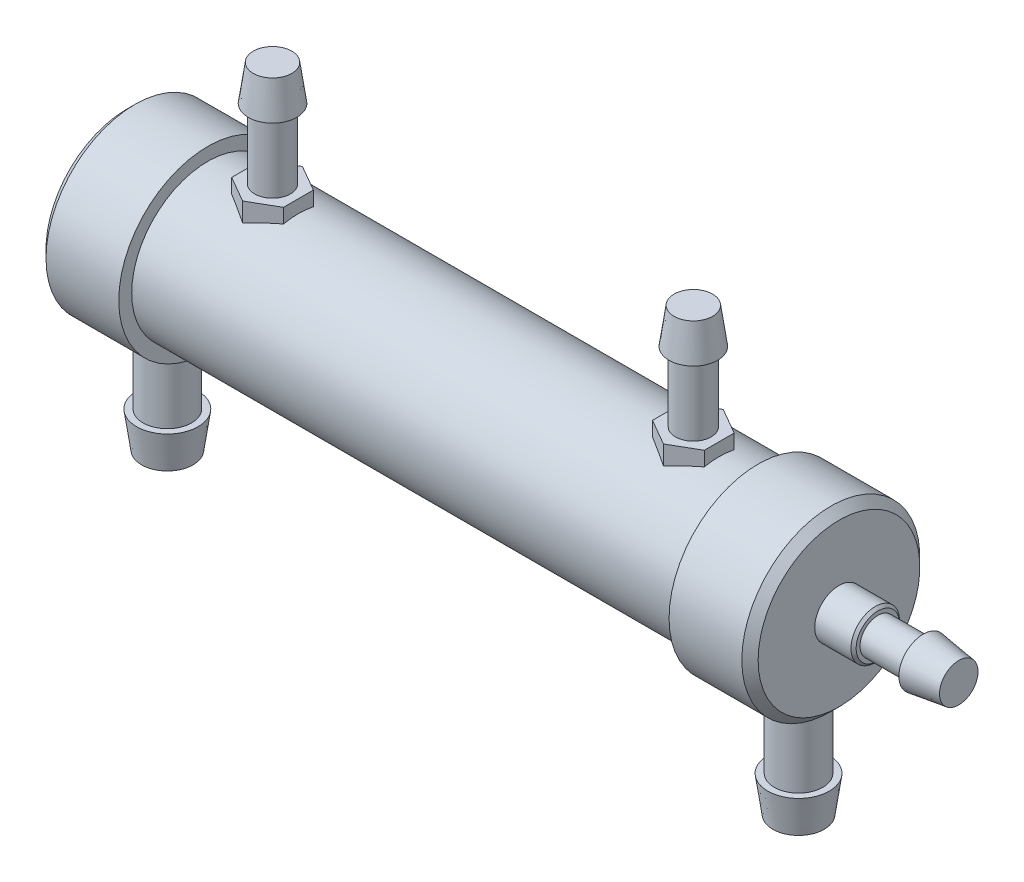
from build123d import *

# Parameters (mm, degrees)
BOSS_EXTRUDE1_DEPTH = 17.4625
CHAMFER1_SIZE       = 1.6002
CHAMFER2_SIZE       = 0.508


with BuildPart() as part:
    # Sketch1 → Revolve1 (revolve)
    with BuildSketch(Plane.XY):
        Polygon((0, 0), (0, 17.4625), (15.875, 17.4625), (15.875, 14.9225), (123.825, 14.9225), (123.825, 17.4625), (139.7, 17.4625), (139.7, 4.7625), (147.32, 4.7625), (147.32, 3.4925), (156.21, 3.4925), (156.21, 4.7625), (163.195, 3.78082227), (163.195, 0), align=None)
    revolve(axis=Axis((0, 0, 0), (1, 0, 0)))



with BuildPart() as body_2:
    # Sketch2 → Revolve2 (revolve)
    with BuildSketch(Plane.XY):
        Polygon((12.7, -17.4625), (12.7, -31.115), (13.97, -31.115), (12.98832227, -38.1), (7.9375, -38.1), (7.9375, -17.4625), align=None)
    revolve(axis=Axis((7.9375, -0.261290097, 0), (0, -1, 0)))


with BuildPart() as body_3:
    # Sketch3 → Revolve3 (revolve)
    with BuildSketch(Plane.XY):
        Polygon((25.0825, 14.9225), (25.0825, 31.115), (23.8125, 31.115), (24.79417773, 38.1), (28.575, 38.1), (28.575, 14.9225), align=None)
    revolve(axis=Axis((28.575, -0.825209821, 0), (0, 1, 0)))


with BuildPart() as body_4:
    # Mirror4: mirrored copy
    add(body_2.part.mirror(Plane.ZY.offset(-69.85)))


with BuildPart() as body_5:
    # Mirror4 2: mirrored copy
    add(body_3.part.mirror(Plane.ZY.offset(-69.85)))


with BuildPart() as part_1:
    add(part.part)

    add(body_3.part)  # Boss-Extrude1 merges body 3
    # Sketch4 → Boss-Extrude1 (add)
    with BuildSketch(Plane(origin=(0, 0, 0), x_dir=(1, 0, 0), z_dir=(0, 1, 0))):
        Polygon((33.655, -2.932939367), (33.655, 2.932939367), (28.575, 5.865878735), (23.495, 2.932939367), (23.495, -2.932939367), (28.575, -5.865878735), align=None)
        Polygon((111.125, -5.865878735), (116.205, -2.932939367), (116.205, 2.932939367), (111.125, 5.865878735), (106.045, 2.932939367), (106.045, -2.932939367), align=None)
    extrude(amount=BOSS_EXTRUDE1_DEPTH)

    # Chamfer1
    chamfer1_edges = [part_1.edges().sort_by_distance(p)[0] for p in [
        (139.7, -17.4625, 0),
        (0, -17.4625, 0),
    ]]
    chamfer(chamfer1_edges, length=CHAMFER1_SIZE)

    # Chamfer2
    chamfer2_edges = [part_1.edges().sort_by_distance(p)[0] for p in [
        (147.32, -4.7625, 0),
    ]]
    chamfer(chamfer2_edges, length=CHAMFER2_SIZE)


solid = Compound([body_2.part, body_4.part, body_5.part, part_1.part])
